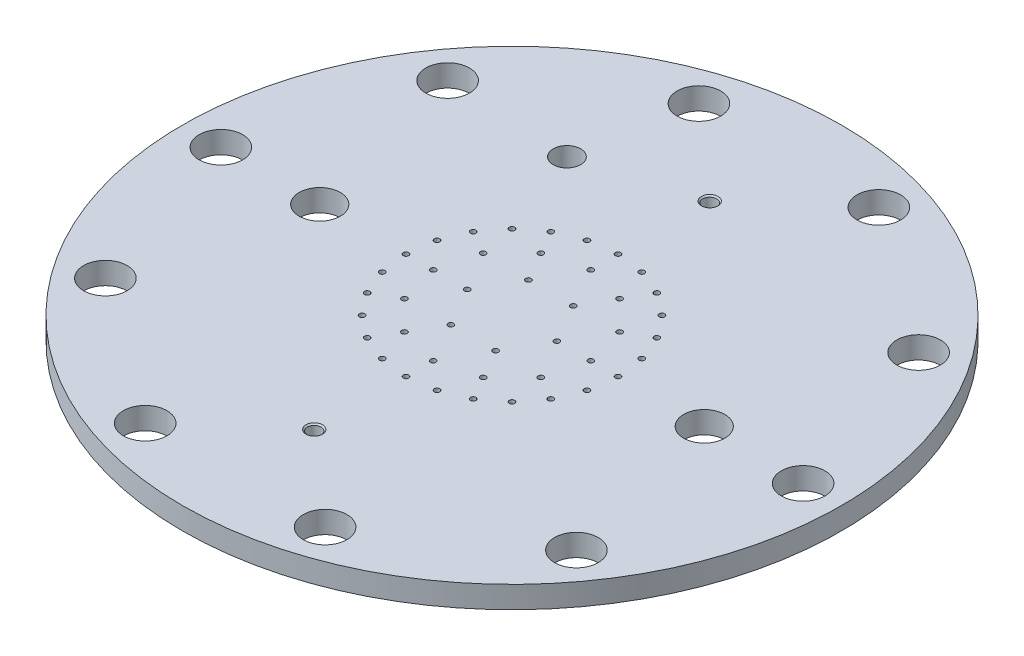
from build123d import *

# Parameters (mm, degrees)
F_3_8_CLEARANCE_HOLE1_D                = 10.0838
CIRPATTERN1_COUNT                      = 10
F_3_8_0_375_DIAMETER_HOLE1_D           = 9.525
F_1_4_0_25_DIAMETER_HOLE1_D            = 6.35
CUT_EXTRUDE1_DEPTH                     = 108.882743755
CUT_EXTRUDE1_DEPTH_BACK                = 108.882743755
SKETCH7_R                              = 0.635
F_1_8_0_125_DIAMETER_HOLE1_D           = 3.175
F_1_8_0_125_DIAMETER_HOLE1_CSINK_D     = 3.81
F_1_8_0_125_DIAMETER_HOLE1_CSINK_ANGLE = 90


with BuildPart() as part:
    # Sketch1 → Revolve1 (revolve)
    with BuildSketch(Plane.XY):
        Polygon((0, 0), (0, -5.08), (54.8259, -5.08), (54.8259, -2.3876), (58.8899, -2.3876), (58.8899, -5.08), (76.2, -5.08), (76.2, 0), align=None)
    revolve(axis=Axis((0, 0, 0), (0, -1, 0)))

    # 3/8 Clearance Hole1 (through all)
    with Locations(Plane(origin=(67.31, 0, 0), x_dir=(0, 0, 1), z_dir=(0, 1, 0))):
        with Locations((0, 0)):
            f_3_8_clearance_hole1 = Hole(F_3_8_CLEARANCE_HOLE1_D / 2)

    # CirPattern1: 3/8 Clearance Hole1 ×10 about axis
    cirpattern1_axis = Axis((0, -5.334, 0), (0, 1, 0))
    for i in range(1, CIRPATTERN1_COUNT):
        add(f_3_8_clearance_hole1.rotate(cirpattern1_axis, i * 360 / CIRPATTERN1_COUNT), mode=Mode.SUBTRACT)

    # 3/8 (0.375) Diameter Hole1 (through all)
    with Locations(Plane(origin=(44.45, 0, 0), x_dir=(0, 0, 1), z_dir=(0, 1, 0))):
        with Locations((0, 0), (0, -88.9)):
            Hole(F_3_8_0_375_DIAMETER_HOLE1_D / 2)

    # 1/4 (0.25) Diameter Hole1 (through all)
    with Locations(Plane(origin=(-25.4, 0, -38.1), x_dir=(0, 0, 1), z_dir=(0, 1, 0))):
        with Locations((0, 0)):
            Hole(F_1_4_0_25_DIAMETER_HOLE1_D / 2)

    # Sketch7 → Cut-Extrude1 (cut, two sides: drawn at the far end of the back side and taken through both)
    with BuildSketch(Plane(origin=(0, 0, 0), x_dir=(1, 0, 0), z_dir=(0, 1, 0)).offset(-CUT_EXTRUDE1_DEPTH_BACK)):
        with Locations((10.3632, 0)):
            Circle(SKETCH7_R)
        with Locations((18.2118, 0)):
            Circle(SKETCH7_R)
        with Locations((24.511, 0)):
            Circle(SKETCH7_R)
        with Locations((5.1816, -8.974794464)):
            Circle(SKETCH7_R)
        with Locations((-5.1816, -8.974794464)):
            Circle(SKETCH7_R)
        with Locations((-10.3632, 0)):
            Circle(SKETCH7_R)
        with Locations((-5.1816, 8.974794464)):
            Circle(SKETCH7_R)
        with Locations((5.1816, 8.974794464)):
            Circle(SKETCH7_R)
        with Locations((15.771881449, -9.1059)):
            Circle(SKETCH7_R)
        with Locations((9.1059, -15.771881449)):
            Circle(SKETCH7_R)
        with Locations((0, -18.2118)):
            Circle(SKETCH7_R)
        with Locations((-9.1059, -15.771881449)):
            Circle(SKETCH7_R)
        with Locations((-15.771881449, -9.1059)):
            Circle(SKETCH7_R)
        with Locations((-18.2118, 0)):
            Circle(SKETCH7_R)
        with Locations((-15.771881449, 9.1059)):
            Circle(SKETCH7_R)
        with Locations((-9.1059, 15.771881449)):
            Circle(SKETCH7_R)
        with Locations((0, 18.2118)):
            Circle(SKETCH7_R)
        with Locations((9.1059, 15.771881449)):
            Circle(SKETCH7_R)
        with Locations((15.771881449, 9.1059)):
            Circle(SKETCH7_R)
        with Locations((23.675807928, -6.343913615)):
            Circle(SKETCH7_R)
        with Locations((21.227148672, -12.2555)):
            Circle(SKETCH7_R)
        with Locations((17.331894314, -17.331894314)):
            Circle(SKETCH7_R)
        with Locations((12.2555, -21.227148672)):
            Circle(SKETCH7_R)
        with Locations((6.343913615, -23.675807928)):
            Circle(SKETCH7_R)
        with Locations((0, -24.511)):
            Circle(SKETCH7_R)
        with Locations((-6.343913615, -23.675807928)):
            Circle(SKETCH7_R)
        with Locations((-12.2555, -21.227148672)):
            Circle(SKETCH7_R)
        with Locations((-17.331894314, -17.331894314)):
            Circle(SKETCH7_R)
        with Locations((-21.227148672, -12.2555)):
            Circle(SKETCH7_R)
        with Locations((-23.675807928, -6.343913615)):
            Circle(SKETCH7_R)
        with Locations((-24.511, 0)):
            Circle(SKETCH7_R)
        with Locations((-23.675807928, 6.343913615)):
            Circle(SKETCH7_R)
        with Locations((-21.227148672, 12.2555)):
            Circle(SKETCH7_R)
        with Locations((-17.331894314, 17.331894314)):
            Circle(SKETCH7_R)
        with Locations((-12.2555, 21.227148672)):
            Circle(SKETCH7_R)
        with Locations((-6.343913615, 23.675807928)):
            Circle(SKETCH7_R)
        with Locations((0, 24.511)):
            Circle(SKETCH7_R)
        with Locations((6.343913615, 23.675807928)):
            Circle(SKETCH7_R)
        with Locations((12.2555, 21.227148672)):
            Circle(SKETCH7_R)
        with Locations((17.331894314, 17.331894314)):
            Circle(SKETCH7_R)
        with Locations((21.227148672, 12.2555)):
            Circle(SKETCH7_R)
        with Locations((23.675807928, 6.343913615)):
            Circle(SKETCH7_R)
    extrude(amount=CUT_EXTRUDE1_DEPTH + CUT_EXTRUDE1_DEPTH_BACK, mode=Mode.SUBTRACT)

    # 1/8 (0.125) Diameter Hole1 (through all)
    with Locations(Plane(origin=(0, 0, 45.72), x_dir=(0, 0, 1), z_dir=(0, 1, 0))):
        with Locations((0, 0), (-91.44, 0)):
            CounterSinkHole(F_1_8_0_125_DIAMETER_HOLE1_D / 2, F_1_8_0_125_DIAMETER_HOLE1_CSINK_D / 2, counter_sink_angle=F_1_8_0_125_DIAMETER_HOLE1_CSINK_ANGLE)


solid = part.part
